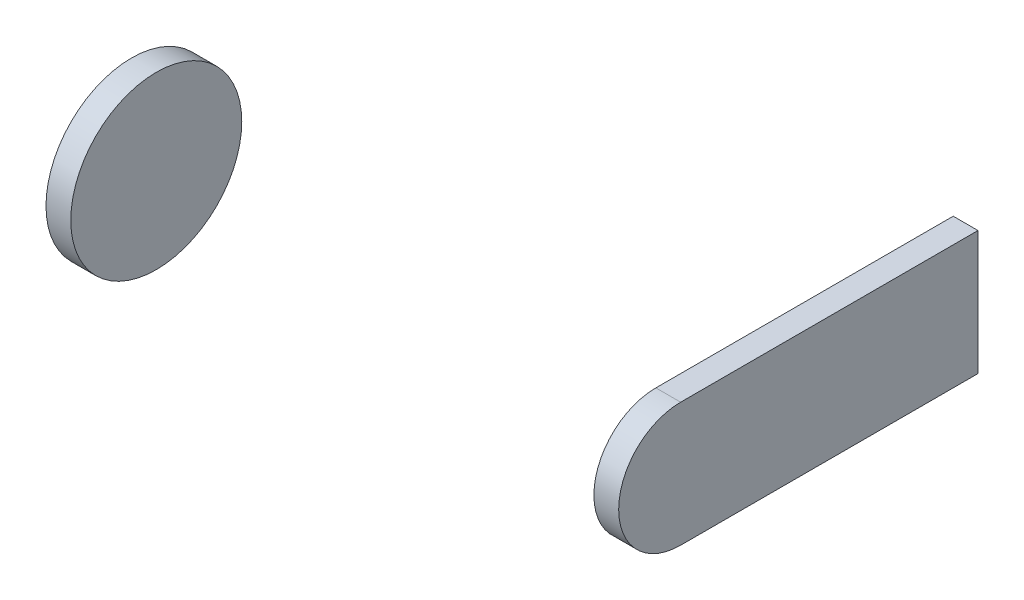
from build123d import *

# Parameters (mm, degrees)
SKETCH1_R                                    = 17.25
MOTOR_PLATE_DEPTH                            = 5
SKETCH2_R                                    = 12.5
BEARING_SIDE_DEPTH                           = 5
SKETCH3_R                                    = 5
BEARING_NUB_ONLY_CONTACTS_INNER_HUB_OF_DEPTH = 1.5
BEARING_NUB_FILLET_5MM_R                     = 5
BOSS_EXTRUDE4_DEPTH                          = 5


with BuildPart() as part:
    # Sketch1 → Motor plate (new body)
    with BuildSketch(Plane.ZY.offset(30.797658267)):
        with Locations((55.776129099, 32.277474859)):
            Circle(SKETCH1_R)
    extrude(amount=MOTOR_PLATE_DEPTH)


with BuildPart() as body_2:
    # Sketch2 → Bearing side (new body)
    with BuildSketch(Plane(origin=(70.002341733, 0, 0), x_dir=(0, 0, -1), z_dir=(1, 0, 0))):
        with Locations(Location((-55.776129099, 32.277474859, 0), (0, 0, 90))):
            Circle(SKETCH2_R)
    extrude(amount=BEARING_SIDE_DEPTH)

    # Sketch3 → Bearing nub (only contacts inner hub of bearing) (add)
    with BuildSketch(Plane.ZY.offset(-70.002341733)):
        with Locations(Location((55.776129099, 32.277474859, 0), (0, 0, 270))):
            Circle(SKETCH3_R)
    extrude(amount=BEARING_NUB_ONLY_CONTACTS_INNER_HUB_OF_DEPTH)

    # Bearing nub fillet 5mm
    # the kernel refuses this fillet: 5 mm, written as the material it adds along each edge
    with BuildSketch(Plane(origin=(70.002341733, 32.277474859, 55.776129099), x_dir=(0, -1, 0), z_dir=(0, 0, -1))) as bearing_nub_fillet_5mm_piece_1:
        with BuildLine():
            CenterArc((8.570714214, 5), BEARING_NUB_FILLET_5MM_R, 224.427004001, 45.572995999)
            Line((5, 1.5), (4.928585716, 1.43))
            ThreePointArc((4.928585716, 1.43), (4.9, 0.75), (4.9, 0))
            Line((4.9, 0), (5, -0.1))
            Line((5, -0.1), (8.570714214, -0.1))
            Line((8.570714214, -0.1), (8.570714214, 0))
        make_face()
    revolve(axis=Axis((70.002341733, 32.277474859, 55.776129099), (-1, 0, 0)))

    # Sketch4 → Boss-Extrude4 (add)
    with BuildSketch(Plane(origin=(75.002341733, 0, 0), x_dir=(0, 0, -1), z_dir=(1, 0, 0))):
        with BuildLine():
            Line((-55.776129099, 44.777474859), (4.223870901, 44.777474859))
            Line((4.223870901, 44.777474859), (4.223870901, 19.777474859))
            Line((4.223870901, 19.777474859), (-55.776129099, 19.777474859))
            ThreePointArc((-55.776129099, 19.777474859), (-68.276129099, 32.277474859), (-55.776129099, 44.777474859))
        make_face()
    extrude(amount=-BOSS_EXTRUDE4_DEPTH)


solid = Compound([part.part, body_2.part])
